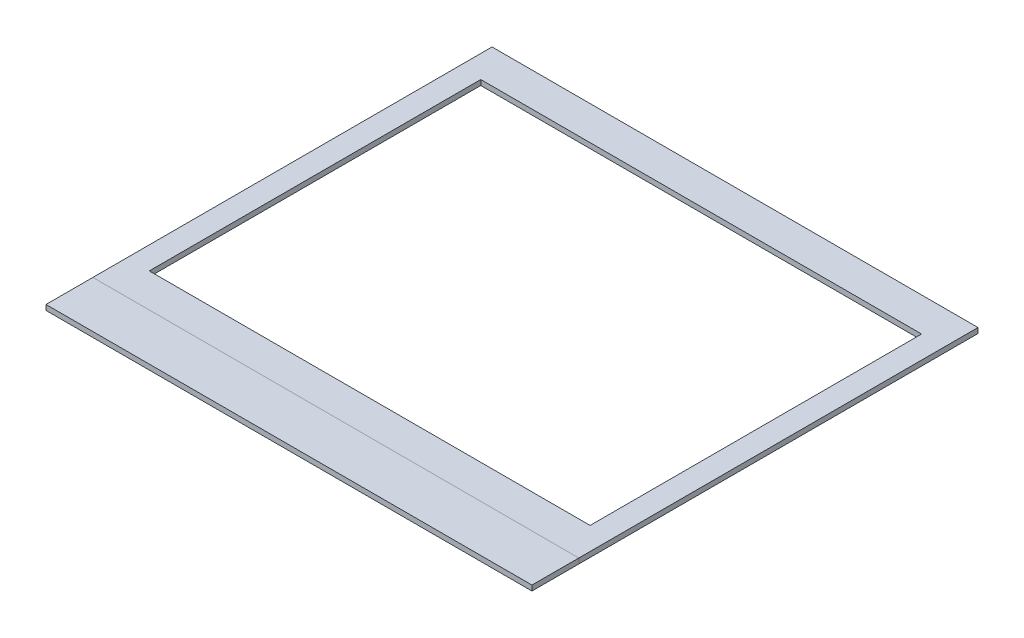
from build123d import *

# Parameters (mm, degrees)
SKETCH1_W           = 280
SKETCH1_H           = 230
SKETCH1_W_2         = 254
SKETCH1_H_2         = 191
BOSS_EXTRUDE1_DEPTH = 3
SKETCH4_W           = 280
SKETCH4_H           = 27
BOSS_EXTRUDE2_DEPTH = 3


with BuildPart() as part:
    # Sketch1 → Boss-Extrude1 (new body)
    with BuildSketch(Plane(origin=(0, 0, 0), x_dir=(1, 0, 0), z_dir=(0, 1, 0))):
        with Locations((140, 115)):
            Rectangle(SKETCH1_W, SKETCH1_H)
        with Locations((140, 115)):
            Rectangle(SKETCH1_W_2, SKETCH1_H_2, mode=Mode.SUBTRACT)
    extrude(amount=BOSS_EXTRUDE1_DEPTH)


with BuildPart() as body_2:
    # Sketch4 → Boss-Extrude2 (new body)
    with BuildSketch(Plane(origin=(0, 3, 0), x_dir=(1, 0, 0), z_dir=(0, 1, 0))):
        with Locations((140, -13.5)):
            Rectangle(SKETCH4_W, SKETCH4_H)
    extrude(amount=-BOSS_EXTRUDE2_DEPTH)


solid = Compound([part.part, body_2.part])
